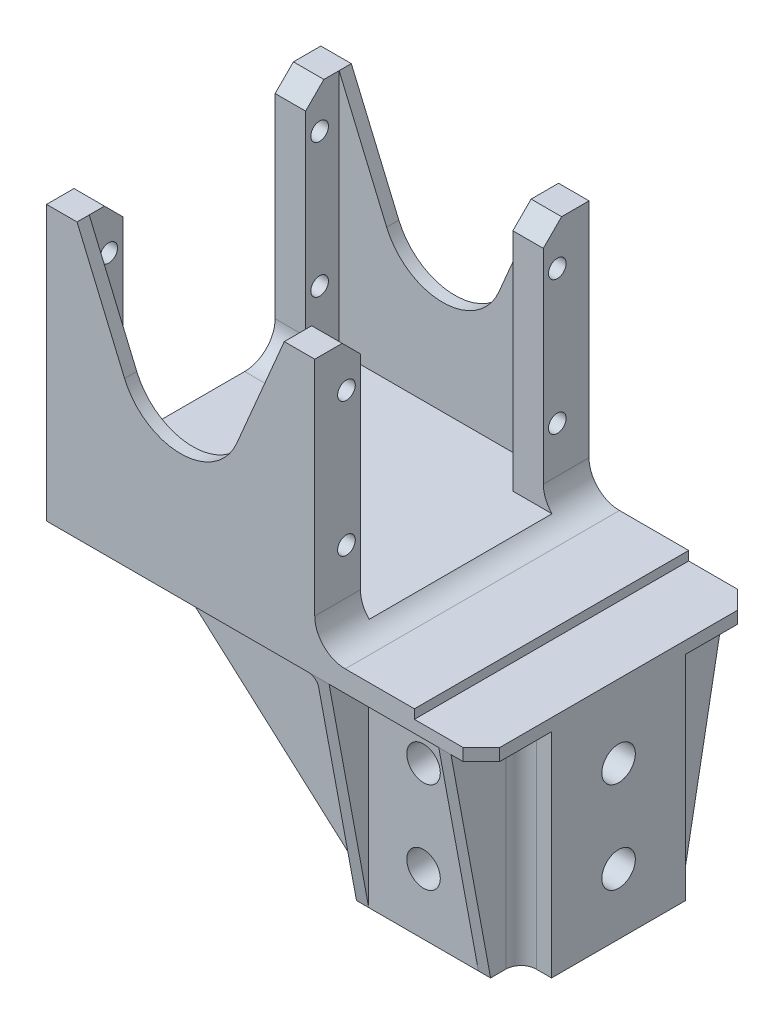
from build123d import *

# Parameters (mm, degrees)
BOSS_EXTRUDE1_DEPTH           = 45
SKETCH3_W                     = 30
SKETCH3_H                     = 40
CUT_EXTRUDE1_DEPTH            = 88.304481557
SKETCH4_W                     = 32
SKETCH4_H                     = 32
SKETCH4_W_2                   = 20.5
SKETCH4_H_2                   = 20.5
BOSS_EXTRUDE2_DEPTH           = 35
SKETCH6_W                     = 5
SKETCH6_H                     = 5
CUT_EXTRUDE4_DEPTH            = 35
RIB1_REACH                    = 87.394
SKETCH9_WALL_W                = 225.450736488
SKETCH9_WALL_H                = 2
LPATTERN1_COUNT               = 2
LPATTERN1_PITCH               = 20
RIB6_REACH                    = 100.659
SKETCH14_WALL_W               = 234.916193708
SKETCH14_WALL_H               = 2
RIB7_START                    = -2
RIB7_DEPTH                    = 2
FILLET2_R                     = 5
FILLET3_R                     = 5
RIB10_REACH                   = 92.525
SKETCH17_WALL_W               = 226.513312862
SKETCH17_WALL_H               = 2
RIB11_REACH                   = 92.525
SKETCH18_WALL_W               = 226.513312862
SKETCH18_WALL_H               = 2
FILLET4_R                     = 10
LPATTERN2_COUNT               = 2
LPATTERN2_PITCH               = 43
FILLET4_OF_LPATTERN2_R        = 10
M5_CLEARANCE_HOLE2_AT_2_COUNT = 2
M5_CLEARANCE_HOLE2_AT_2_PITCH = 15
M2_5_CLEARANCE_HOLE1_D        = 2.9
FILLET5_R                     = 2.5
SKETCH4_4_R                   = 2.5
BOSS_EXTRUDE4_DEPTH           = 8
CIRPATTERN1_COUNT             = 4
CHAMFER1_SIZE                 = 3
FILLET6_R                     = 5
FILLET7_R                     = 1.5
SKETCH27_W                    = 27.35
SKETCH27_H                    = 6.5
CUT_EXTRUDE6_DEPTH            = 91.525342619
FILLET8_R                     = 5
SKETCH29_W                    = 11
SKETCH29_H                    = 45
CUT_EXTRUDE7_DEPTH            = 1.5


# Read off the part's stored shape, not the designer's step: Rib7
with BuildPart() as part:
    # Sketch2 → Boss-Extrude1 (new body)
    with BuildSketch(Plane.XY):
        Polygon((-53.5125, -22.5), (17.8375, -22.5), (17.8375, -17.5), (-9.5125, -17.5), (-9.5125, 22.5), (-14.5125, 22.5), (-14.5125, -17.5), (-48.5125, -17.5), (-48.5125, 22.5), (-53.5125, 22.5), align=None)
    extrude(amount=BOSS_EXTRUDE1_DEPTH)

    # Sketch3 → Cut-Extrude1 (cut, through all)
    with BuildSketch(Plane(origin=(-53.5125, 0, 0), x_dir=(0, 0, -1), z_dir=(1, 0, 0))):
        with Locations((-22.5, 2.5)):
            Rectangle(SKETCH3_W, SKETCH3_H)
    extrude(amount=CUT_EXTRUDE1_DEPTH, mode=Mode.SUBTRACT)

    # Sketch4 → Boss-Extrude2 (add)
    with BuildSketch(Plane.XZ.offset(22.5)):
        with Locations((1.8375, 22.5)):
            Rectangle(SKETCH4_W, SKETCH4_H)
        with Locations((1.8375, 22.5)):
            Rectangle(SKETCH4_W_2, SKETCH4_H_2, mode=Mode.SUBTRACT)
    extrude(amount=BOSS_EXTRUDE2_DEPTH)

    # Sketch6 → Cut-Extrude4 (cut)
    with BuildSketch(Plane(origin=(0, -57.5, 0), x_dir=(-1, 0, 0), z_dir=(0, -1, 0))):
        with Locations((11.6625, -36)):
            Rectangle(SKETCH6_W, SKETCH6_H)
        with Locations((-15.3375, -36)):
            Rectangle(SKETCH6_W, SKETCH6_H)
        with Locations((-15.3375, -9)):
            Rectangle(SKETCH6_W, SKETCH6_H)
        with Locations((11.6625, -9)):
            Rectangle(SKETCH6_W, SKETCH6_H)
    extrude(amount=-CUT_EXTRUDE4_DEPTH, mode=Mode.SUBTRACT)

    # Sketch9 wall → Rib1 (add, up to next)
    with BuildSketch(Plane(origin=(-33.8375, -40, 33.5), x_dir=(-0.747199752598, 0.664599525818, 0), z_dir=(-0.664599525818, -0.747199752598, 0)), mode=Mode.PRIVATE) as rib1_sk1:
        with Locations((0, 1)):
            Rectangle(SKETCH9_WALL_W, SKETCH9_WALL_H)
    rib1_tool1 = extrude(rib1_sk1.sketch, amount=-RIB1_REACH, mode=Mode.PRIVATE) - part.part
    rib1 = rib1_tool1.solids().sort_by_distance((-33.8375, -40, 33.5))[0]
    add(rib1)

    # LPattern1: Rib1 ×2
    with Locations(*[(0, 0, -i * LPATTERN1_PITCH) for i in range(1, LPATTERN1_COUNT)]):
        add(rib1)

    # Sketch14 wall → Rib6 (add, up to next)
    with BuildSketch(Plane(origin=(12.8375, -40, 3.25), x_dir=(0, 0.983188736076, -0.182592193843), z_dir=(0, 0.182592193843, 0.983188736076)), mode=Mode.PRIVATE) as rib6_sk1:
        with Locations((0, 1)):
            Rectangle(SKETCH14_WALL_W, SKETCH14_WALL_H)
    rib6_tool1 = extrude(rib6_sk1.sketch, amount=RIB6_REACH, mode=Mode.PRIVATE) - part.part
    rib6 = rib6_tool1.solids().sort_by_distance((12.8375, -40, 3.25))[0]
    add(rib6)

    # Rib7 outline → Rib7 (add)
    with BuildSketch(Plane.ZY.offset(9.1625).offset(RIB7_START)):
        Polygon((0, -22.5), (6.5, -57.5), (6.5, -22.5), align=None)
    rib7 = extrude(amount=RIB7_DEPTH)

    # Fillet2
    fillet2_edges = [part.edges().sort_by_distance(p)[0] for p in [
        (1.8375, -22.5, 38.5),
        (-14.1625, -22.5, 22.5),
        (1.8375, -22.5, 6.5),
    ]]
    fillet(fillet2_edges, radius=FILLET2_R)

    # Fillet3
    fillet3_edges = [part.edges().sort_by_distance(p)[0] for p in [
        (-9.5125, -17.5, 41.25),
        (-9.5125, -17.5, 3.75),
    ]]
    fillet(fillet3_edges, radius=FILLET3_R)

    # Sketch17 wall → Rib10 (add, up to next)
    with BuildSketch(Plane(origin=(-40.0125, 2.5, 45), x_dir=(0.391140640345, -0.920330918458, 0), z_dir=(0.920330918458, 0.391140640345, 0)), mode=Mode.PRIVATE) as rib10_sk1:
        with Locations((0, 1)):
            Rectangle(SKETCH17_WALL_W, SKETCH17_WALL_H)
    rib10_tool1 = extrude(rib10_sk1.sketch, amount=-RIB10_REACH, mode=Mode.PRIVATE) - part.part
    rib10 = rib10_tool1.solids().sort_by_distance((-40.0125, 2.5, 45))[0]
    add(rib10)

    # Sketch18 wall → Rib11 (add, up to next)
    with BuildSketch(Plane(origin=(-23.0125, 2.5, 45), x_dir=(0.391140640345, 0.920330918458, 0), z_dir=(-0.920330918458, 0.391140640345, 0)), mode=Mode.PRIVATE) as rib11_sk1:
        with Locations((0, 1)):
            Rectangle(SKETCH18_WALL_W, SKETCH18_WALL_H)
    rib11_tool1 = extrude(rib11_sk1.sketch, amount=-RIB11_REACH, mode=Mode.PRIVATE) - part.part
    rib11 = rib11_tool1.solids().sort_by_distance((-23.0125, 2.5, 45))[0]
    add(rib11)

    # Fillet4
    # the kernel refuses this fillet: 10 mm, written as the material it adds along each edge
    with BuildSketch(Plane(origin=(-31.5125, -17.5, 45), x_dir=(-0.391140640345148, 0.9203309184583486, 0), z_dir=(0, 0, -1))) as fillet4_piece_1:
        with BuildLine():
            CenterArc((FILLET4_R * 2.35294117647, FILLET4_R), FILLET4_R, 136.050984017, 133.949015983)
            Line((FILLET4_R * 1.63298352692, FILLET4_R * 1.69401799894), (0, 0))
            Line((0, 0), (FILLET4_R * 2.35294117647, 0))
        make_face()
    extrude(amount=2)

    # LPattern2: Rib10, Rib11 ×2
    with Locations(*[(0, 0, -i * LPATTERN2_PITCH) for i in range(1, LPATTERN2_COUNT)]):
        add(rib10)
        add(rib11)

    # Fillet4 of LPattern2
    # the kernel refuses this fillet: 10 mm, written as the material it adds along each edge
    with BuildSketch(Plane(origin=(-31.5125, -17.5, 60.823529412), x_dir=(-0.39114064034514817, 0.9203309184583486, 0), z_dir=(0, 0, -1))) as fillet4_of_lpattern2_piece_1_section:
        with BuildLine():
            CenterArc((FILLET4_OF_LPATTERN2_R * 2.35294117647, FILLET4_OF_LPATTERN2_R), FILLET4_OF_LPATTERN2_R, 136.050984017, 133.949015983)
            Line((FILLET4_OF_LPATTERN2_R * 1.63298352692, FILLET4_OF_LPATTERN2_R * 1.69401799894), (0, 0))
            Line((0, 0), (FILLET4_OF_LPATTERN2_R * 2.35294117647, 0))
        make_face()
    fillet4_of_lpattern2_piece_1 = extrude(amount=60.823529412, mode=Mode.PRIVATE)
    fillet4_of_lpattern2_piece_1 = split(fillet4_of_lpattern2_piece_1, bisect_by=Plane(origin=(-31.5125, -6.311496297, 43), z_dir=(0, 0, 1)), keep=Keep.TOP, mode=Mode.PRIVATE)
    fillet4_of_lpattern2_piece_1 = split(fillet4_of_lpattern2_piece_1, bisect_by=Plane(origin=(-31.5125, -6.311496297, 45), z_dir=(0, 0, -1)), keep=Keep.TOP, mode=Mode.PRIVATE)
    add(fillet4_of_lpattern2_piece_1)
    with BuildSketch(Plane(origin=(-31.5125, -17.5, 2), x_dir=(-0.391140640345148, 0.9203309184583486, 0), z_dir=(0, 0, -1))) as fillet4_of_lpattern2_piece_2:
        with BuildLine():
            CenterArc((FILLET4_OF_LPATTERN2_R * 2.35294117647, FILLET4_OF_LPATTERN2_R), FILLET4_OF_LPATTERN2_R, 136.050984017, 133.949015983)
            Line((FILLET4_OF_LPATTERN2_R * 1.63298352692, FILLET4_OF_LPATTERN2_R * 1.69401799894), (0, 0))
            Line((0, 0), (FILLET4_OF_LPATTERN2_R * 2.35294117647, 0))
        make_face()
    extrude(amount=2)

    # Sketch22 → M5 Clearance Hole2 (revolve, cut)
    with BuildSketch(Plane(origin=(1.8375, -32.5, 38.5), x_dir=(0, -1, 0), z_dir=(1, 0, 0))):
        Polygon((0, 0), (0, 7.652366702), (2.75, 6), (2.75, 0), align=None)
    m5_clearance_hole2 = revolve(axis=Axis((1.8375, -32.5, 44.85), (0, 0, -1)), mode=Mode.SUBTRACT)

    # M5 Clearance Hole2 at 2: M5 Clearance Hole2 ×2
    with Locations(*[(0, -i * M5_CLEARANCE_HOLE2_AT_2_PITCH, 0) for i in range(1, M5_CLEARANCE_HOLE2_AT_2_COUNT)]):
        add(m5_clearance_hole2, mode=Mode.SUBTRACT)

    # M2.5 Clearance Hole1 (through all)
    with Locations(Plane.ZY.offset(53.5125)):
        with Locations((5.2, 15.5), (39.8, 15.5), (39.8, -6.5), (5.2, -6.5)):
            Hole(M2_5_CLEARANCE_HOLE1_D / 2)

    # Fillet5
    fillet5_edges = [part.edges().sort_by_distance(p)[0] for p in [
        (-9.1625, -40, 11.5),
        (12.8375, -40, 11.5),
        (12.8375, -40, 33.5),
        (-9.1625, -40, 33.5),
    ]]
    fillet(fillet5_edges, radius=FILLET5_R)

    # Sketch4<4> → Boss-Extrude4 (add)
    with BuildSketch(Plane.XZ.offset(22.5)):
        with Locations(Location((1.8375, 22.5, 0), (0, 0, 180))):
            Circle(SKETCH4_4_R)
    extrude(amount=BOSS_EXTRUDE4_DEPTH)

    # CirPattern1: M5 Clearance Hole2 ×4 about axis
    cirpattern1_axis = Axis((1.8375, -30.5, 22.5), (0, -1, 0))
    for i in range(1, CIRPATTERN1_COUNT):
        add(m5_clearance_hole2.rotate(cirpattern1_axis, i * 360 / CIRPATTERN1_COUNT), mode=Mode.SUBTRACT)

    # CirPattern1 copy 1 sketch → CirPattern1 copy 1 (revolve, cut)
    with BuildSketch(Plane(origin=(-14.1625, -47.5, 22.5), x_dir=(0, -1, 0), z_dir=(0, 0, 1))):
        Polygon((0, 0), (0, 7.652366702), (2.75, 6), (2.75, 0), align=None)
    revolve(axis=Axis((-20.5125, -47.5, 22.5), (1, 0, 0)), mode=Mode.SUBTRACT)

    # CirPattern1 copy 2 sketch → CirPattern1 copy 2 (revolve, cut)
    with BuildSketch(Plane(origin=(1.8375, -47.5, 6.5), x_dir=(0, -1, 0), z_dir=(-1, 0, 0))):
        Polygon((0, 0), (0, 7.652366702), (2.75, 6), (2.75, 0), align=None)
    revolve(axis=Axis((1.8375, -47.5, 0.15), (0, 0, 1)), mode=Mode.SUBTRACT)

    # CirPattern1 copy 3 sketch → CirPattern1 copy 3 (revolve, cut)
    with BuildSketch(Plane(origin=(17.8375, -47.5, 22.5), x_dir=(0, -1, 0), z_dir=(0, 0, -1))):
        Polygon((0, 0), (0, 7.652366702), (2.75, 6), (2.75, 0), align=None)
    revolve(axis=Axis((24.1875, -47.5, 22.5), (-1, 0, 0)), mode=Mode.SUBTRACT)

    # Mirror1: Rib6, Rib7 across plane
    add(rib6.mirror(Plane.XY.offset(22.5)))
    add(rib7.mirror(Plane.XY.offset(22.5)))

    # Chamfer1
    chamfer1_edges = [part.edges().sort_by_distance(p)[0] for p in [
        (17.8375, -20, 0),
        (-12.0125, 22.5, 37.5),
        (-51.0125, 22.5, 37.5),
        (-12.0125, 22.5, 7.5),
        (-51.0125, 22.5, 7.5),
        (17.8375, -20, 45),
    ]]
    chamfer(chamfer1_edges, length=CHAMFER1_SIZE)

    # Fillet6
    fillet6_edges = [part.edges().sort_by_distance(p)[0] for p in [
        (-51.0125, -17.5, 37.5),
        (-51.0125, -17.5, 7.5),
    ]]
    fillet(fillet6_edges, radius=FILLET6_R)

    # Fillet7
    fillet7_edges = [part.edges().sort_by_distance(p)[0] for p in [
        (-9.1625, -22.5, 4.5),
        (-32.5875, -22.5, 33.5),
        (-36.3375, -22.5, 31.5),
        (-36.3375, -22.5, 13.5),
        (-14.1625, -42.5, 13.5),
        (-14.1625, -42.5, 31.5),
        (-15.626966094, -23.964466094, 13.5),
        (-15.626966094, -23.964466094, 31.5),
        (-32.5875, -22.5, 11.5),
        (-9.894733047, -22.5, 10.767766953),
        (-9.1625, -22.5, 40.5),
        (-9.894733047, -22.5, 34.232233047),
    ]]
    fillet(fillet7_edges, radius=FILLET7_R)

    # Sketch27 → Cut-Extrude6 (cut, through all)
    with BuildSketch(Plane.XY.offset(45)):
        with Locations((4.1625, -15.75)):
            Rectangle(SKETCH27_W, SKETCH27_H)
    extrude(amount=-CUT_EXTRUDE6_DEPTH, mode=Mode.SUBTRACT)

    # Fillet8
    # the kernel refuses this fillet: 5 mm, written as the material it adds along each edge
    with BuildSketch(Plane(origin=(-9.5125, -19, 45), x_dir=(0, 1, 0), z_dir=(0, 0, -1))) as fillet8_piece_1_section:
        with BuildLine():
            CenterArc((FILLET8_R, FILLET8_R), FILLET8_R, 180, 90)
            Line((0, FILLET8_R), (0, 0))
            Line((0, 0), (FILLET8_R, 0))
        make_face()
    fillet8_piece_1 = extrude(amount=45, mode=Mode.PRIVATE)
    fillet8_piece_1 = split(fillet8_piece_1, bisect_by=Plane(origin=(-9.182145907, -16.486596265, 37.5), z_dir=(0, 0, 1)), keep=Keep.TOP, mode=Mode.PRIVATE)
    fillet8_piece_1 = split(fillet8_piece_1, bisect_by=Plane(origin=(-9.182145907, -17.5, 41.25), z_dir=(0, 1, 0)), keep=Keep.TOP, mode=Mode.PRIVATE)
    add(fillet8_piece_1)
    with BuildSketch(Plane(origin=(-9.5125, -19, 45), x_dir=(0, 1, 0), z_dir=(0, 0, -1))) as fillet8_piece_2_section:
        with BuildLine():
            CenterArc((FILLET8_R, FILLET8_R), FILLET8_R, 180, 90)
            Line((0, FILLET8_R), (0, 0))
            Line((0, 0), (FILLET8_R, 0))
        make_face()
    fillet8_piece_2 = extrude(amount=45, mode=Mode.PRIVATE)
    fillet8_piece_2 = split(fillet8_piece_2, bisect_by=Plane(origin=(-8.037929362, -18.458415886, 37.5), z_dir=(0, 0, 1)), keep=Keep.TOP, mode=Mode.PRIVATE)
    fillet8_piece_2 = split(fillet8_piece_2, bisect_by=Plane(origin=(-8.037929362, -17.5, 41.25), z_dir=(0, -1, 0)), keep=Keep.TOP, mode=Mode.PRIVATE)
    add(fillet8_piece_2)
    with BuildSketch(Plane(origin=(-9.5125, -19, 45), x_dir=(0, 1, 0), z_dir=(0, 0, -1))) as fillet8_piece_3_section:
        with BuildLine():
            CenterArc((FILLET8_R, FILLET8_R), FILLET8_R, 180, 90)
            Line((0, FILLET8_R), (0, 0))
            Line((0, 0), (FILLET8_R, 0))
        make_face()
    fillet8_piece_3 = extrude(amount=45, mode=Mode.PRIVATE)
    fillet8_piece_3 = split(fillet8_piece_3, bisect_by=Plane(origin=(-8.037929362, -18.458415886, 7.5), z_dir=(0, 0, 1)), keep=Keep.TOP, mode=Mode.PRIVATE)
    fillet8_piece_3 = split(fillet8_piece_3, bisect_by=Plane(origin=(-8.037929362, -18.458415886, 37.5), z_dir=(0, 0, -1)), keep=Keep.TOP, mode=Mode.PRIVATE)
    fillet8_piece_3 = split(fillet8_piece_3, bisect_by=Plane(origin=(-8.037929362, -17.5, 22.5), z_dir=(0, -1, 0)), keep=Keep.TOP, mode=Mode.PRIVATE)
    add(fillet8_piece_3)
    with BuildSketch(Plane(origin=(-9.5125, -19, 45), x_dir=(0, 1, 0), z_dir=(0, 0, -1))) as fillet8_piece_4_section:
        with BuildLine():
            CenterArc((FILLET8_R, FILLET8_R), FILLET8_R, 180, 90)
            Line((0, FILLET8_R), (0, 0))
            Line((0, 0), (FILLET8_R, 0))
        make_face()
    fillet8_piece_4 = extrude(amount=45, mode=Mode.PRIVATE)
    fillet8_piece_4 = split(fillet8_piece_4, bisect_by=Plane(origin=(-9.182145907, -16.486596265, 7.5), z_dir=(0, 0, -1)), keep=Keep.TOP, mode=Mode.PRIVATE)
    fillet8_piece_4 = split(fillet8_piece_4, bisect_by=Plane(origin=(-9.182145907, -17.5, 3.75), z_dir=(0, 1, 0)), keep=Keep.TOP, mode=Mode.PRIVATE)
    add(fillet8_piece_4)
    with BuildSketch(Plane(origin=(-9.5125, -19, 45), x_dir=(0, 1, 0), z_dir=(0, 0, -1))) as fillet8_piece_5_section:
        with BuildLine():
            CenterArc((FILLET8_R, FILLET8_R), FILLET8_R, 180, 90)
            Line((0, FILLET8_R), (0, 0))
            Line((0, 0), (FILLET8_R, 0))
        make_face()
    fillet8_piece_5 = extrude(amount=45, mode=Mode.PRIVATE)
    fillet8_piece_5 = split(fillet8_piece_5, bisect_by=Plane(origin=(-8.037929362, -18.458415886, 7.5), z_dir=(0, 0, -1)), keep=Keep.TOP, mode=Mode.PRIVATE)
    fillet8_piece_5 = split(fillet8_piece_5, bisect_by=Plane(origin=(-8.037929362, -17.5, 3.75), z_dir=(0, -1, 0)), keep=Keep.TOP, mode=Mode.PRIVATE)
    add(fillet8_piece_5)

    # Sketch29 → Cut-Extrude7 (cut)
    with BuildSketch(Plane(origin=(0, -19, 0), x_dir=(1, 0, 0), z_dir=(0, 1, 0))):
        with Locations((12.3375, -22.5)):
            Rectangle(SKETCH29_W, SKETCH29_H)
    extrude(amount=-CUT_EXTRUDE7_DEPTH, mode=Mode.SUBTRACT)


solid = part.part
